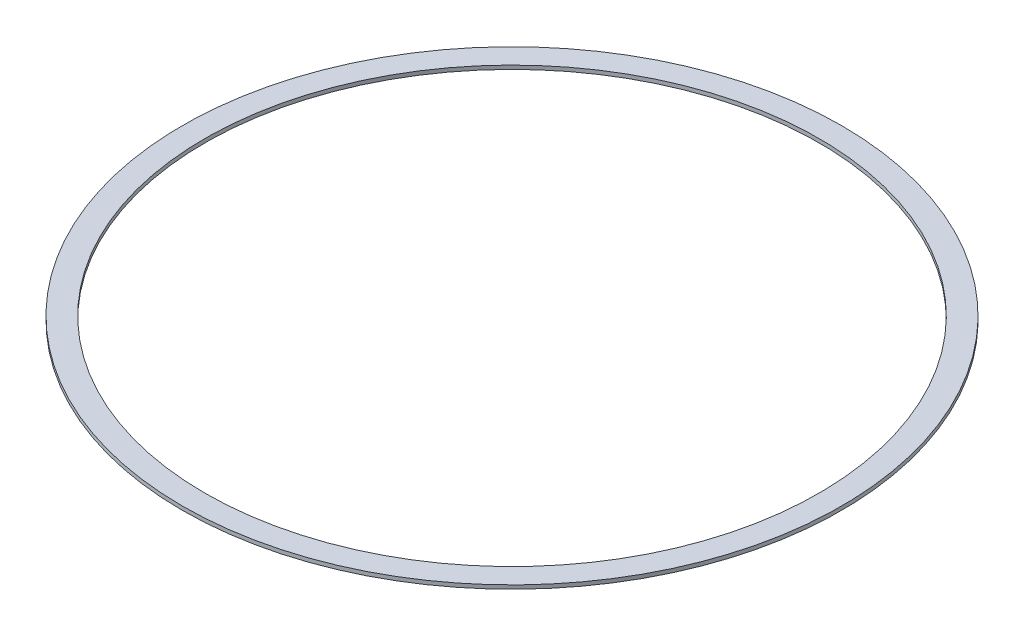
from build123d import *

# Parameters (mm, degrees)
SKETCH1_R           = 221.9579
SKETCH1_R_2         = 206.8449
BOSS_EXTRUDE1_DEPTH = 2.54


with BuildPart() as part:
    # Sketch1 → Boss-Extrude1 (new body)
    with BuildSketch(Plane(origin=(0, 0, 0), x_dir=(1, 0, 0), z_dir=(0, 1, 0))):
        Circle(SKETCH1_R)
        Circle(SKETCH1_R_2, mode=Mode.SUBTRACT)
    extrude(amount=BOSS_EXTRUDE1_DEPTH)


solid = part.part
